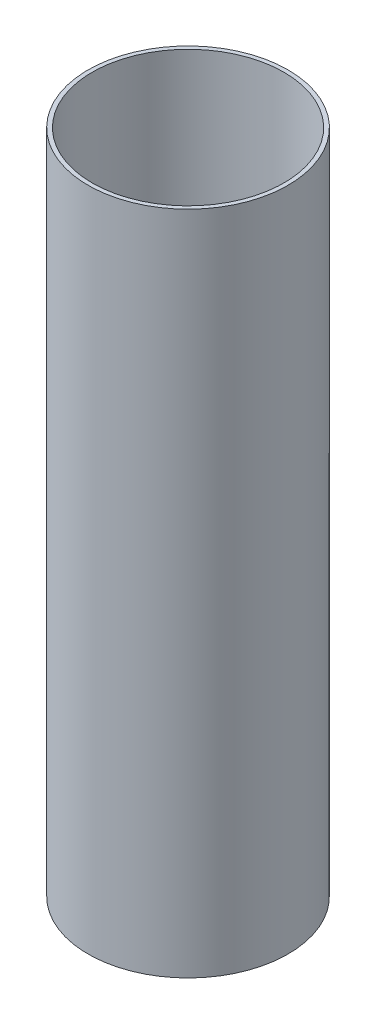
from build123d import *

# Parameters (mm, degrees)
SKETCH2_W = 1.143
SKETCH2_H = 187.325


with BuildPart() as part:
    # Sketch2 → Revolve1 (revolve)
    with BuildSketch(Plane.XY):
        with Locations((27.559, -61.489636293)):
            Rectangle(SKETCH2_W, SKETCH2_H)
    revolve(axis=Axis((0, 0, 0), (0, 1, 0)))


solid = part.part
